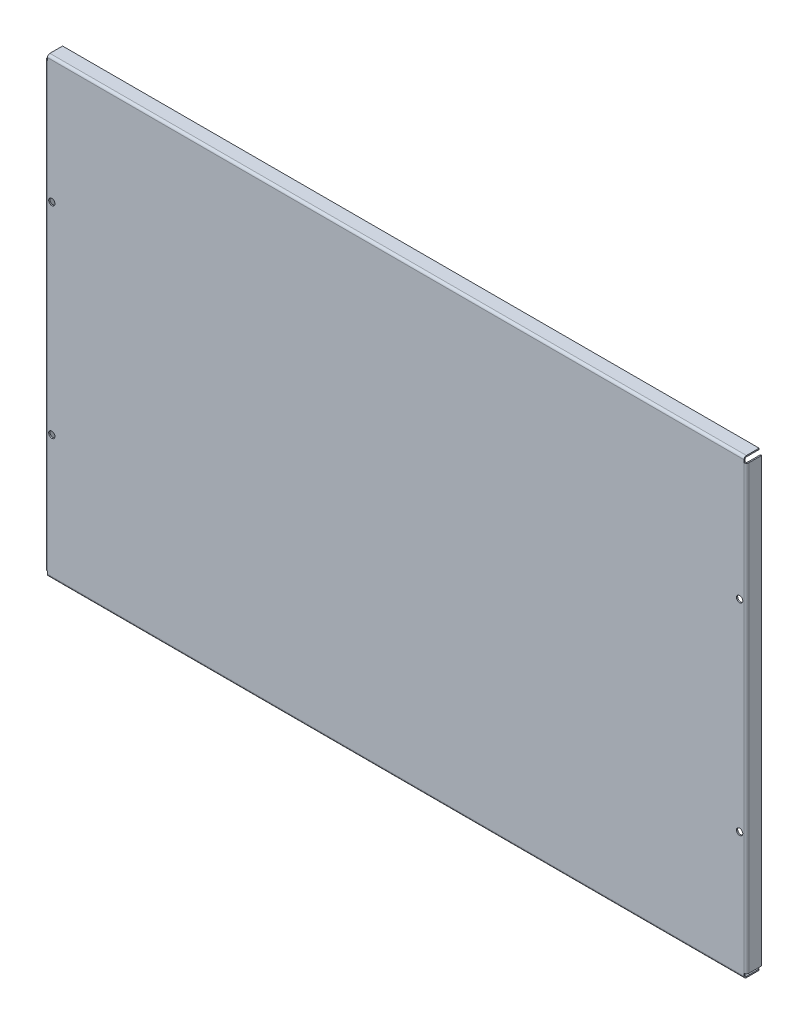
from build123d import *

# Parameters (mm, degrees)
CROQUIS1_W                   = 884.174
CROQUIS1_H                   = 569.976
BRIDA_BASE1_DEPTH            = 1.524
CROQUIS6_W                   = 3.1242
CROQUIS6_H                   = 6.35
CORTAR_EXTRUIR1_DEPTH        = 526.986119863
BRIDA_START                  = -438.9628
BRIDA_DE_ARISTA1_DEPTH       = 877.9256
BRIDA_START_2                = 6.35
BRIDA_DE_ARISTA1_2_DEPTH     = 557.276
BRIDA_DE_ARISTA1_3_DEPTH     = 877.9256
BRIDA_DE_ARISTA1_4_OUTLINE_W = 0.1524
BRIDA_DE_ARISTA1_4_OUTLINE_H = 1.524
BRIDA_DE_ARISTA1_4_DEPTH     = 0.0762
BRIDA_START_3                = 438.8866
BRIDA_DE_ARISTA1_5_OUTLINE_W = 0.1524
BRIDA_DE_ARISTA1_5_OUTLINE_H = 1.524
BRIDA_DE_ARISTA1_5_DEPTH     = 0.0762
BRIDA_DE_ARISTA1_6_DEPTH     = 557.276
CROQUIS19_R                  = 3.9624
CORTAR_EXTRUIR2_DEPTH        = 527.328773879


# Read off the part's stored shape, not the designer's step: Brida de arista1
# Sheet-metal steps are written as plain solids
with BuildPart() as part:
    # Croquis1 → Brida base1 (new body)
    with BuildSketch(Plane.XY):
        Rectangle(CROQUIS1_W, CROQUIS1_H)
    extrude(amount=-BRIDA_BASE1_DEPTH)

    # Croquis6 → Cortar-Extruir1 (cut, through all)
    with BuildSketch(Plane.XY):
        with Locations((440.5249, 281.813)):
            Rectangle(CROQUIS6_W, CROQUIS6_H)
        with Locations((-440.5249, 281.813)):
            Rectangle(CROQUIS6_W, CROQUIS6_H)
        with Locations((-440.5249, -281.813)):
            Rectangle(CROQUIS6_W, CROQUIS6_H)
        with Locations((440.5249, -281.813)):
            Rectangle(CROQUIS6_W, CROQUIS6_H)
    extrude(amount=-CORTAR_EXTRUIR1_DEPTH, mode=Mode.SUBTRACT)

    # Brida de arista1 outline → Brida de arista1 (add)
    with BuildSketch(Plane.YZ.offset(BRIDA_START)):
        with BuildLine():
            Line((284.988, -19.05), (284.988, -3.048))
            ThreePointArc((284.988, -3.048), (284.884141918, -2.259119551), (284.579645431, -1.524))
            Line((284.579645431, -1.524), (281.94, -1.524))
            ThreePointArc((281.94, -1.524), (283.017630735, -1.970369265), (283.464, -3.048))
            Line((283.464, -3.048), (283.464, -19.05))
            Line((283.464, -19.05), (284.988, -19.05))
        make_face()
        with BuildLine():
            ThreePointArc((-283.464, -3.048), (-283.017630735, -1.970369265), (-281.94, -1.524))
            Line((-281.94, -1.524), (-284.579645431, -1.524))
            ThreePointArc((-284.579645431, -1.524), (-284.884141918, -2.259119551), (-284.988, -3.048))
            Line((-284.988, -3.048), (-284.988, -19.05))
            Line((-284.988, -19.05), (-283.464, -19.05))
            Line((-283.464, -19.05), (-283.464, -3.048))
        make_face()
    extrude(amount=BRIDA_DE_ARISTA1_DEPTH)

    # Brida de arista1 2 outline → Brida de arista1 2 (add)
    with BuildSketch(Plane(origin=(0, 284.988, -1.524), x_dir=(-1, 0, 0), z_dir=(0, -1, 0)).offset(BRIDA_START_2)):
        with BuildLine():
            Line((-440.563, 1.524), (-440.563, 17.526))
            Line((-440.563, 17.526), (-442.087, 17.526))
            Line((-442.087, 17.526), (-442.087, 1.524))
            ThreePointArc((-442.087, 1.524), (-441.983141918, 0.735119551), (-441.678645431, 0))
            Line((-441.678645431, 0), (-439.039, 0))
            ThreePointArc((-439.039, 0), (-440.116630735, 0.446369265), (-440.563, 1.524))
        make_face()
        with BuildLine():
            ThreePointArc((440.563, 1.524), (440.116630735, 0.446369265), (439.039, 0))
            Line((439.039, 0), (441.678645431, 0))
            ThreePointArc((441.678645431, 0), (441.983141918, 0.735119551), (442.087, 1.524))
            Line((442.087, 1.524), (442.087, 17.526))
            Line((442.087, 17.526), (440.563, 17.526))
            Line((440.563, 17.526), (440.563, 1.524))
        make_face()
    extrude(amount=BRIDA_DE_ARISTA1_2_DEPTH)

    # Brida de arista1 3 outline → Brida de arista1 3 (cut)
    with BuildSketch(Plane.YZ.offset(BRIDA_START)):
        with BuildLine():
            ThreePointArc((281.94, 0), (283.464, -0.408354569), (284.579645431, -1.524))
            Line((284.579645431, -1.524), (284.988, -1.524))
            Line((284.988, -1.524), (284.988, 0))
            Line((284.988, 0), (281.94, 0))
        make_face()
        with BuildLine():
            ThreePointArc((-284.579645431, -1.524), (-283.464, -0.408354569), (-281.94, 0))
            Line((-281.94, 0), (-284.988, 0))
            Line((-284.988, 0), (-284.988, -1.524))
            Line((-284.988, -1.524), (-284.579645431, -1.524))
        make_face()
    extrude(amount=BRIDA_DE_ARISTA1_3_DEPTH, mode=Mode.SUBTRACT)

    # Brida de arista1 4 outline → Brida de arista1 4 (cut)
    with BuildSketch(Plane.YZ.offset(BRIDA_START)):
        with Locations((278.7142, -0.762)):
            Rectangle(BRIDA_DE_ARISTA1_4_OUTLINE_W, BRIDA_DE_ARISTA1_4_OUTLINE_H)
        with Locations((-278.7142, -0.762)):
            Rectangle(BRIDA_DE_ARISTA1_4_OUTLINE_W, BRIDA_DE_ARISTA1_4_OUTLINE_H)
    extrude(amount=BRIDA_DE_ARISTA1_4_DEPTH, mode=Mode.SUBTRACT)

    # Brida de arista1 5 outline → Brida de arista1 5 (cut)
    with BuildSketch(Plane.YZ.offset(BRIDA_START_3)):
        with Locations((278.7142, -0.762)):
            Rectangle(BRIDA_DE_ARISTA1_5_OUTLINE_W, BRIDA_DE_ARISTA1_5_OUTLINE_H)
        with Locations((-278.7142, -0.762)):
            Rectangle(BRIDA_DE_ARISTA1_5_OUTLINE_W, BRIDA_DE_ARISTA1_5_OUTLINE_H)
    extrude(amount=BRIDA_DE_ARISTA1_5_DEPTH, mode=Mode.SUBTRACT)

    # Brida de arista1 6 outline → Brida de arista1 6 (cut)
    with BuildSketch(Plane(origin=(0, 284.988, -1.524), x_dir=(-1, 0, 0), z_dir=(0, -1, 0)).offset(BRIDA_START_2)):
        with BuildLine():
            ThreePointArc((-439.039, -1.524), (-440.563, -1.115645431), (-441.678645431, 0))
            Line((-441.678645431, 0), (-442.087, 0))
            Line((-442.087, 0), (-442.087, -1.524))
            Line((-442.087, -1.524), (-439.039, -1.524))
        make_face()
        with BuildLine():
            Line((442.087, 0), (441.678645431, 0))
            ThreePointArc((441.678645431, 0), (440.563, -1.115645431), (439.039, -1.524))
            Line((439.039, -1.524), (442.087, -1.524))
            Line((442.087, -1.524), (442.087, 0))
        make_face()
    extrude(amount=BRIDA_DE_ARISTA1_6_DEPTH, mode=Mode.SUBTRACT)

    # Croquis19 → Cortar-Extruir2 (cut, through all)
    with BuildSketch(Plane.XY):
        with Locations((-433.451, 127)):
            Circle(CROQUIS19_R)
        with Locations((-433.451, -127)):
            Circle(CROQUIS19_R)
        with Locations((433.451, 127)):
            Circle(CROQUIS19_R)
        with Locations((433.451, -127)):
            Circle(CROQUIS19_R)
    extrude(amount=-CORTAR_EXTRUIR2_DEPTH, mode=Mode.SUBTRACT)


solid = part.part
